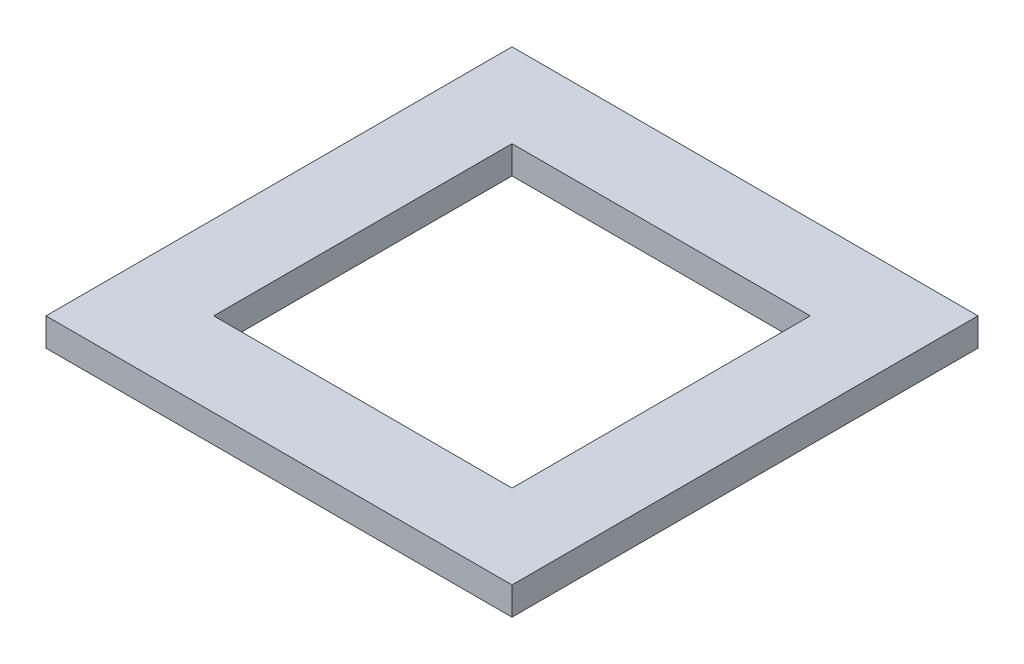
from build123d import *

# Parameters (mm, degrees)
SKETCH1_W           = 50
SKETCH1_H           = 50
SKETCH1_W_2         = 32
SKETCH1_H_2         = 32
BOSS_EXTRUDE1_DEPTH = 3
SKETCH3_R           = 1.8
CUT_EXTRUDE1_DEPTH  = 1.5


with BuildPart() as part:
    # Sketch1 → Boss-Extrude1 (new body)
    with BuildSketch(Plane(origin=(0, 0, 0), x_dir=(1, 0, 0), z_dir=(0, 1, 0))):
        Rectangle(SKETCH1_W, SKETCH1_H)
        Rectangle(SKETCH1_W_2, SKETCH1_H_2, mode=Mode.SUBTRACT)
    extrude(amount=BOSS_EXTRUDE1_DEPTH)

    # Sketch3 → Cut-Extrude1 (cut)
    with BuildSketch(Plane(origin=(0, 0, 0), x_dir=(1, 0, 0), z_dir=(0, 1, 0))):
        with Locations((-22, 22)):
            Circle(SKETCH3_R)
        with Locations((22, 22)):
            Circle(SKETCH3_R)
        with Locations((22, -22)):
            Circle(SKETCH3_R)
        with Locations((-22, -22)):
            Circle(SKETCH3_R)
    extrude(amount=CUT_EXTRUDE1_DEPTH, mode=Mode.SUBTRACT)


solid = part.part
